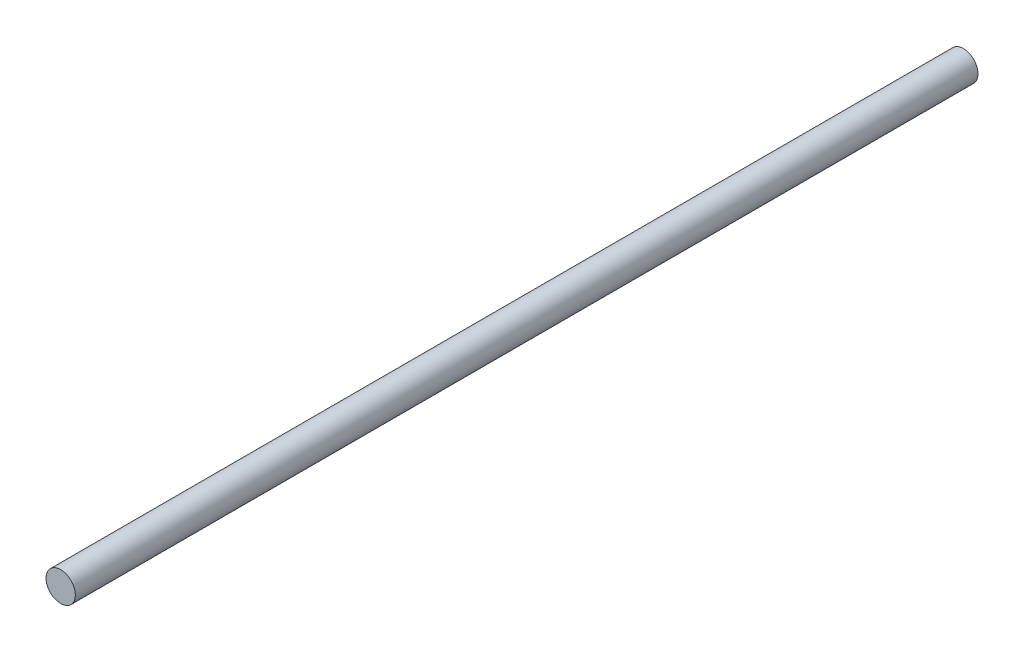
from build123d import *

# Parameters (mm, degrees)
BOSS_EXTRUDE1_OUTLINE_R = 6.35
BOSS_EXTRUDE1_DEPTH     = 390.57326


# Read off the part's stored shape, not the designer's step: Boss-Extrude1
with BuildPart() as part:
    # Boss-Extrude1 outline → Boss-Extrude1 (new body)
    with BuildSketch(Plane.XY.offset(-22.86)):
        Circle(BOSS_EXTRUDE1_OUTLINE_R)
    extrude(amount=BOSS_EXTRUDE1_DEPTH)


solid = part.part
